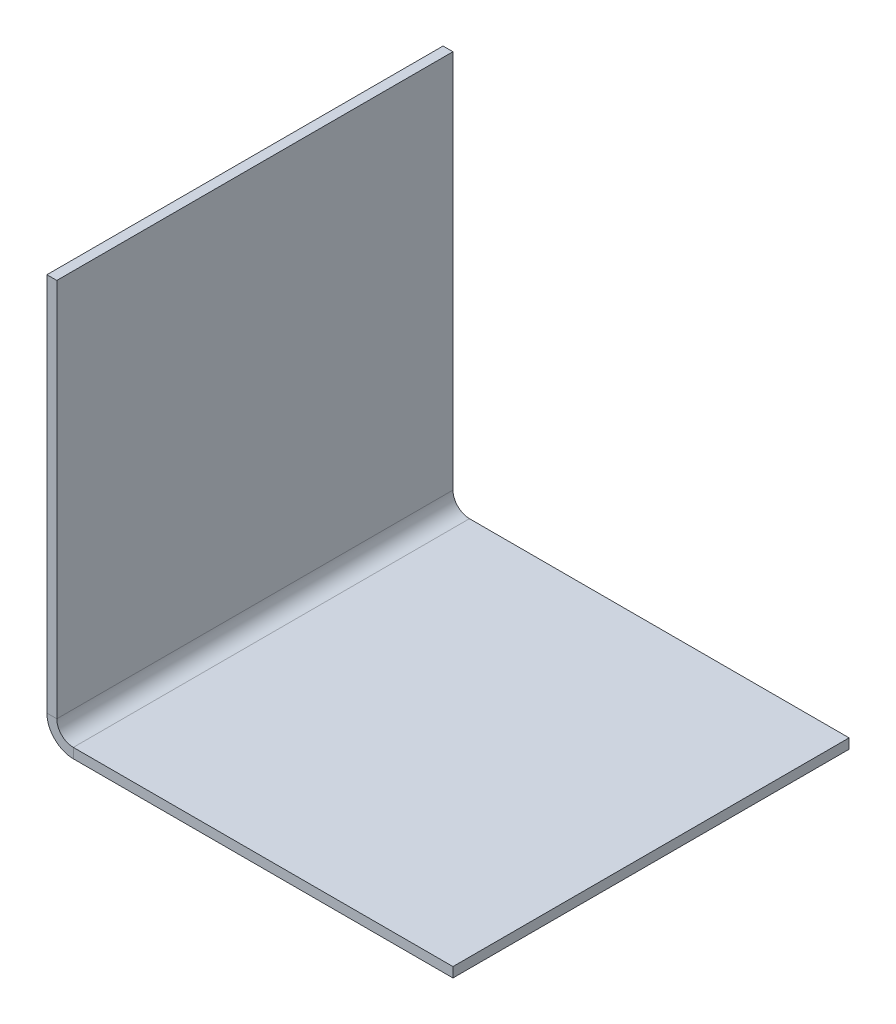
from build123d import *

# Parameters (mm, degrees)
SKETCH1_W              = 120
SKETCH1_H              = 120
BOSS_EXTRUDE1_DEPTH    = 3
SKETCH2_W              = 3
SKETCH2_H              = 120
BOSS_EXTRUDE2_DEPTH    = 123
CONVERT_SOLID2_START   = -60
CONVERT_SOLID2_DEPTH   = 120
CONVERT_SOLID2_2_DEPTH = 120


# Read off the part's stored shape, not the designer's step: Convert-Solid2
with BuildPart() as part:
    # Sketch1 → Boss-Extrude1 (new body)
    with BuildSketch(Plane(origin=(0, 0, 0), x_dir=(1, 0, 0), z_dir=(0, 1, 0))):
        Rectangle(SKETCH1_W, SKETCH1_H)
    extrude(amount=BOSS_EXTRUDE1_DEPTH)

    # Sketch2 → Boss-Extrude2 (add)
    with BuildSketch(Plane.XZ):
        with Locations((-61.5, 0)):
            Rectangle(SKETCH2_W, SKETCH2_H)
    extrude(amount=-BOSS_EXTRUDE2_DEPTH)

    # Convert-Solid2 outline → Convert-Solid2 (cut)
    with BuildSketch(Plane.XY.offset(CONVERT_SOLID2_START)):
        with BuildLine():
            Line((-63, 0), (-55, 0))
            ThreePointArc((-55, 0), (-60.656854249, 2.343145751), (-63, 8))
            Line((-63, 8), (-63, 0))
        make_face()
    extrude(amount=CONVERT_SOLID2_DEPTH, mode=Mode.SUBTRACT)

    # Convert-Solid2 2 outline → Convert-Solid2 2 (add)
    with BuildSketch(Plane.XY.offset(CONVERT_SOLID2_START)):
        with BuildLine():
            Line((-60, 3), (-55, 3))
            ThreePointArc((-55, 3), (-58.535533906, 4.464466094), (-60, 8))
            Line((-60, 8), (-60, 3))
        make_face()
    extrude(amount=CONVERT_SOLID2_2_DEPTH)


solid = part.part
